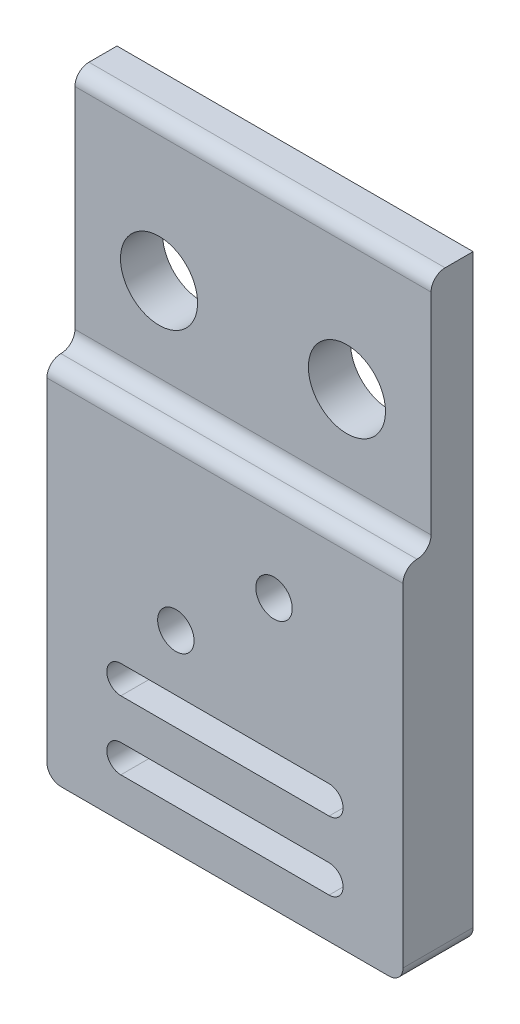
from build123d import *

# Parameters (mm, degrees)
SKETCH1_W           = 25.4
SKETCH1_H           = 20
SKETCH1_R           = 2.75
BOSS_EXTRUDE1_DEPTH = 3
SKETCH2_W           = 25.4
SKETCH2_H           = 25.75
SKETCH2_R           = 1.3
BOSS_EXTRUDE2_DEPTH = 5
FILLET1_R           = 1
FILLET2_R           = 1


with BuildPart() as part:
    # Sketch1 → Boss-Extrude1 (new body)
    with BuildSketch(Plane.XY):
        Rectangle(SKETCH1_W, SKETCH1_H)
        with Locations((6.7, 0)):
            Circle(SKETCH1_R, mode=Mode.SUBTRACT)
        with Locations(Location((-6.7, 0, 0), (0, 0, 180))):
            Circle(SKETCH1_R, mode=Mode.SUBTRACT)
    extrude(amount=BOSS_EXTRUDE1_DEPTH)

    # Sketch2 → Boss-Extrude2 (add)
    with BuildSketch(Plane.XY):
        with Locations((0, -19.875)):
            Rectangle(SKETCH2_W, SKETCH2_H)
        with Locations((-3.5, -19)):
            Circle(SKETCH2_R, mode=Mode.SUBTRACT)
        with Locations((3.5, -13.5)):
            Circle(SKETCH2_R, mode=Mode.SUBTRACT)
        with BuildLine():
            Line((-7.426009093, -23), (7.426009093, -23))
            ThreePointArc((7.426009093, -23), (8.426009093, -24), (7.426009093, -25))
            Line((7.426009093, -25), (-7.426009093, -25))
            ThreePointArc((-7.426009093, -25), (-8.426009093, -24), (-7.426009093, -23))
        make_face(mode=Mode.SUBTRACT)
        with BuildLine():
            Line((-7.426009093, -29.880803462), (7.426009093, -29.880803462))
            ThreePointArc((7.426009093, -29.880803462), (8.426009093, -28.880803462), (7.426009093, -27.880803462))
            Line((7.426009093, -27.880803462), (-7.426009093, -27.880803462))
            ThreePointArc((-7.426009093, -27.880803462), (-8.426009093, -28.880803462), (-7.426009093, -29.880803462))
        make_face(mode=Mode.SUBTRACT)
    extrude(amount=BOSS_EXTRUDE2_DEPTH)

    # Fillet1
    fillet1_edges = [part.edges().sort_by_distance(p)[0] for p in [
        (-8.426009093, -24, 0),
        (0, -25, 0),
        (8.426009093, -24, 0),
        (0, -23, 0),
        (-8.426009093, -28.880803462, 0),
        (0, -29.880803462, 0),
        (8.426009093, -28.880803462, 0),
        (0, -27.880803462, 0),
    ]]
    fillet(fillet1_edges, radius=FILLET1_R)

    # Fillet2
    fillet2_edges = [part.edges().sort_by_distance(p)[0] for p in [
        (0, 10, 3),
        (0, -7, 5),
        (0, -7, 3),
        (12.7, -32.75, 2.5),
        (-12.7, -32.75, 2.5),
    ]]
    fillet(fillet2_edges, radius=FILLET2_R - 0.0001)  # a hair under: the kernel refuses the full size


solid = part.part
